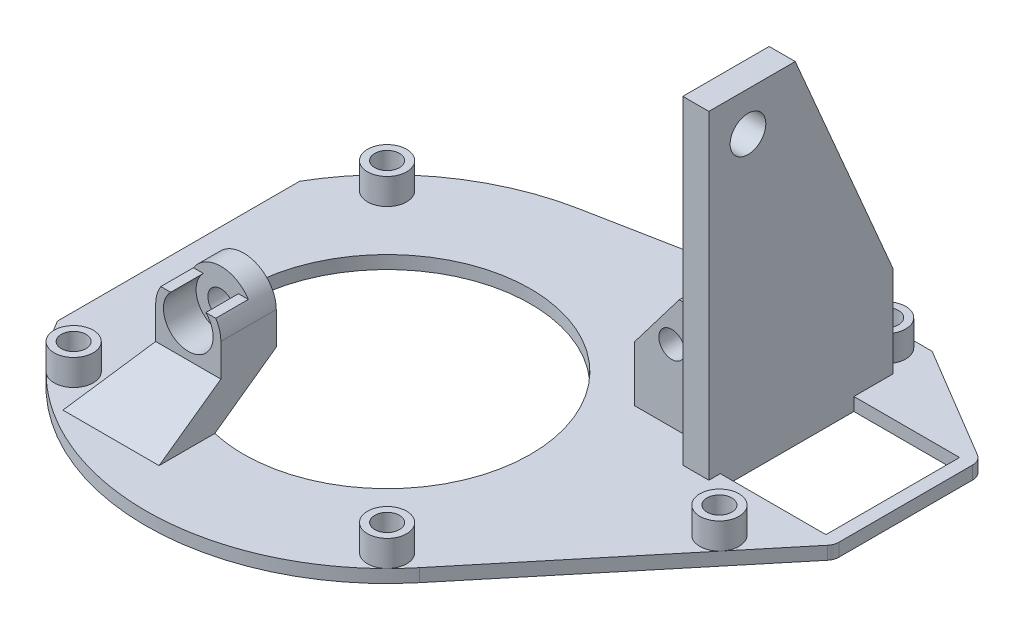
from build123d import *

# Parameters (mm, degrees)
SKETCH2_R                = 22
SKETCH2_W                = 16.20928
SKETCH2_H                = 20.5
BOSS_EXTRUDE1_DEPTH      = 2
SKETCH6_R                = 2
BOSS_EXTRUDE3_DEPTH      = 5.6
SKETCH7_R                = 2.739
BOSS_EXTRUDE4_DEPTH      = 4
BOSS_EXTRUDE5_DEPTH      = 5
BOSS_EXTRUDE5_DEPTH_BACK = 3.5
SKETCH9_R                = 2
LOFT4_START              = -19.749341788
LOFT4_DEPTH              = 14.749341788
LOFT4_START_2            = 11
LOFT4_2_DEPTH            = 20
CUT_EXTRUDE1_START       = -5
SKETCH11_R               = 3.81
CUT_EXTRUDE1_DEPTH       = 5
CUT_EXTRUDE2_REACH       = 99.148
SKETCH12_R               = 3
BOSS_EXTRUDE9_DEPTH      = 4
SKETCH14_R               = 1.9
CUT_EXTRUDE3_DEPTH       = 86.385585859
CUT_EXTRUDE5_START       = -5
CUT_EXTRUDE5_DEPTH       = 5


with BuildPart() as part:
    # Sketch2 → Boss-Extrude1 (new body)
    with BuildSketch(Plane(origin=(0, 0, 0), x_dir=(1, 0, 0), z_dir=(0, 1, 0))):
        with BuildLine():
            Line((35.10955, 44.5), (-7.045717951, 36.322965993))
            ThreePointArc((-7.045717951, 36.322965993), (-21.445207215, 30.151336413), (-32, 18.574175621))
            Line((-32, 18.574175621), (-32, -18.574175621))
            ThreePointArc((-32, -18.574175621), (-3.042934445, -36.874659998), (28.522340191, -23.568540685))
            Line((28.522340191, -23.568540685), (56.860578118, 10.726024828))
            ThreePointArc((56.860578118, 10.726024828), (57.200783272, 11.323056958), (57.31883, 12))
            Line((57.31883, 12), (57.31883, 32.5))
            ThreePointArc((57.31883, 32.5), (57.058008676, 33.487551282), (56.343572466, 34.21752813))
            Line((56.343572466, 34.21752813), (39.10955, 44.5))
            Line((39.10955, 44.5), (35.10955, 44.5))
        make_face()
        with Locations(Location((0, 0, 0), (0, 0, 270))):
            Circle(SKETCH2_R, mode=Mode.SUBTRACT)
        with Locations((47.21419, 22.25)):
            Rectangle(SKETCH2_W, SKETCH2_H, mode=Mode.SUBTRACT)
    extrude(amount=-BOSS_EXTRUDE1_DEPTH)

    # Sketch6 → Boss-Extrude3 (add)
    with BuildSketch(Plane.XY.offset(-14.45)):
        Polygon((23.512808221, 0), (23.512808221, 8.5), (30.35955, 17.5), (35.10955, 17.5), (35.10955, 0), align=None)
        with Locations((29.22955, 11)):
            Circle(SKETCH6_R, mode=Mode.SUBTRACT)
    extrude(amount=-BOSS_EXTRUDE3_DEPTH)

    # Sketch7 → Boss-Extrude4 (add)
    with BuildSketch(Plane(origin=(35.10955, 0, 0), x_dir=(0, 0, -1), z_dir=(1, 0, 0))):
        Polygon((44.5, 0), (10.25, 0), (10.25, 49), (23.5, 49), align=None)
        with Locations((16.25, 43)):
            Circle(SKETCH7_R, mode=Mode.SUBTRACT)
    extrude(amount=BOSS_EXTRUDE4_DEPTH)



with BuildPart() as body_2:
    # Sketch9 → Boss-Extrude5 (new, two sides: drawn at the far end of the back side and taken through both)
    with BuildSketch(Plane.XY.offset(15.5).offset(-BOSS_EXTRUDE5_DEPTH_BACK)):
        with BuildLine():
            Line((-15, 11.75), (-15, 6.75))
            Line((-15, 6.75), (-10, 6.75))
            Line((-10, 6.75), (-5, 6.75))
            Line((-5, 6.75), (-5, 11.75))
            ThreePointArc((-5, 11.75), (-10, 16.75), (-15, 11.75))
        make_face()
        with Locations((-10, 11.75)):
            Circle(SKETCH9_R, mode=Mode.SUBTRACT)
    extrude(amount=BOSS_EXTRUDE5_DEPTH + BOSS_EXTRUDE5_DEPTH_BACK)


with BuildPart() as part_1:
    add(part.part)

    add(body_2.part)  # Loft4 merges body 2
    # Loft4: read off the stored shape, not the designer's step
    # Loft4 outline → Loft4 (add)
    with BuildSketch(Plane.YZ.offset(LOFT4_START)):
        Polygon((6.75, 20.5), (0, 29.981530337), (0, 21.424285286), (6.75, 12), align=None)
    extrude(amount=LOFT4_DEPTH)

    # Loft4 2 outline → Loft4 2 (cut)
    with BuildSketch(Plane.XY.offset(LOFT4_START_2)):
        Polygon((-19.749341788, 0), (-15, 6.75), (-19.749341788, 6.75), align=None)
    extrude(amount=LOFT4_2_DEPTH, mode=Mode.SUBTRACT)

    # Sketch11 → Cut-Extrude1 (cut)
    with BuildSketch(Plane.XY.offset(20.5).offset(CUT_EXTRUDE1_START)):
        with Locations((-10, 11.75)):
            Circle(SKETCH11_R)
    extrude(amount=CUT_EXTRUDE1_DEPTH, mode=Mode.SUBTRACT)

    # Sketch13 → Cut-Extrude2 (cut, up to next)
    with BuildSketch(Plane(origin=(39.10955, 0, 0), x_dir=(0, 0, -1), z_dir=(1, 0, 0)), mode=Mode.PRIVATE) as cut_extrude2_sk1:
        Polygon((44.5, 0), (38.5, 0), (38.5, 14), align=None)
    cut_extrude2_tool1 = extrude(cut_extrude2_sk1.sketch, amount=-CUT_EXTRUDE2_REACH, mode=Mode.PRIVATE) & part_1.part
    add(cut_extrude2_tool1.solids().sort_by_distance((39.10955, 4.666667, -40.5))[0], mode=Mode.SUBTRACT)

    # Sketch12 → Boss-Extrude9 (add)
    with BuildSketch(Plane(origin=(0, 0, 0), x_dir=(1, 0, 0), z_dir=(0, 1, 0))):
        with Locations(Location((-24.04163056, 24.04163056, 0), (0, 0, 134.999512051))):
            Circle(SKETCH12_R)
        with Locations(Location((-24.04163056, -24.04163056, 0), (0, 0, 224.999512051))):
            Circle(SKETCH12_R)
        with Locations(Location((24.04163056, -24.04163056, 0), (0, 0, 314.999512068))):
            Circle(SKETCH12_R)
        with Locations(Location((47.21419, 3.761759805, 0), (0, 0, 320.432443614))):
            Circle(SKETCH12_R)
        with Locations((35.10955, 41.444082154)):
            Circle(SKETCH12_R)
    extrude(amount=BOSS_EXTRUDE9_DEPTH)

    # Sketch14 → Cut-Extrude3 (cut, through all)
    with BuildSketch(Plane(origin=(0, 4, 0), x_dir=(1, 0, 0), z_dir=(0, 1, 0))):
        with Locations(Location((-24.04163056, 24.04163056, 0), (0, 0, 270))):
            Circle(SKETCH14_R)
        with Locations(Location((35.10955, 41.444082154, 0), (0, 0, 270))):
            Circle(SKETCH14_R)
        with Locations(Location((47.21419, 3.761759805, 0), (0, 0, 270))):
            Circle(SKETCH14_R)
        with Locations(Location((24.04163056, -24.04163056, 0), (0, 0, 270))):
            Circle(SKETCH14_R)
        with Locations(Location((-24.04163056, -24.04163056, 0), (0, 0, 270))):
            Circle(SKETCH14_R)
    extrude(amount=-CUT_EXTRUDE3_DEPTH, mode=Mode.SUBTRACT)

    # Sketch18 → Cut-Extrude5 (cut)
    with BuildSketch(Plane.XY.offset(20.5).offset(CUT_EXTRUDE5_START)):
        with BuildLine():
            Line((-10, 11.75), (-12.694076836, 14.444076836))
            Line((-12.694076836, 14.444076836), (-14.212119419, 14.444076836))
            ThreePointArc((-14.212119419, 14.444076836), (-10, 16.75), (-5.787880581, 14.444076836))
            Line((-5.787880581, 14.444076836), (-7.305923164, 14.444076836))
            Line((-7.305923164, 14.444076836), (-10, 11.75))
        make_face()
    extrude(amount=CUT_EXTRUDE5_DEPTH, mode=Mode.SUBTRACT)


solid = part_1.part
